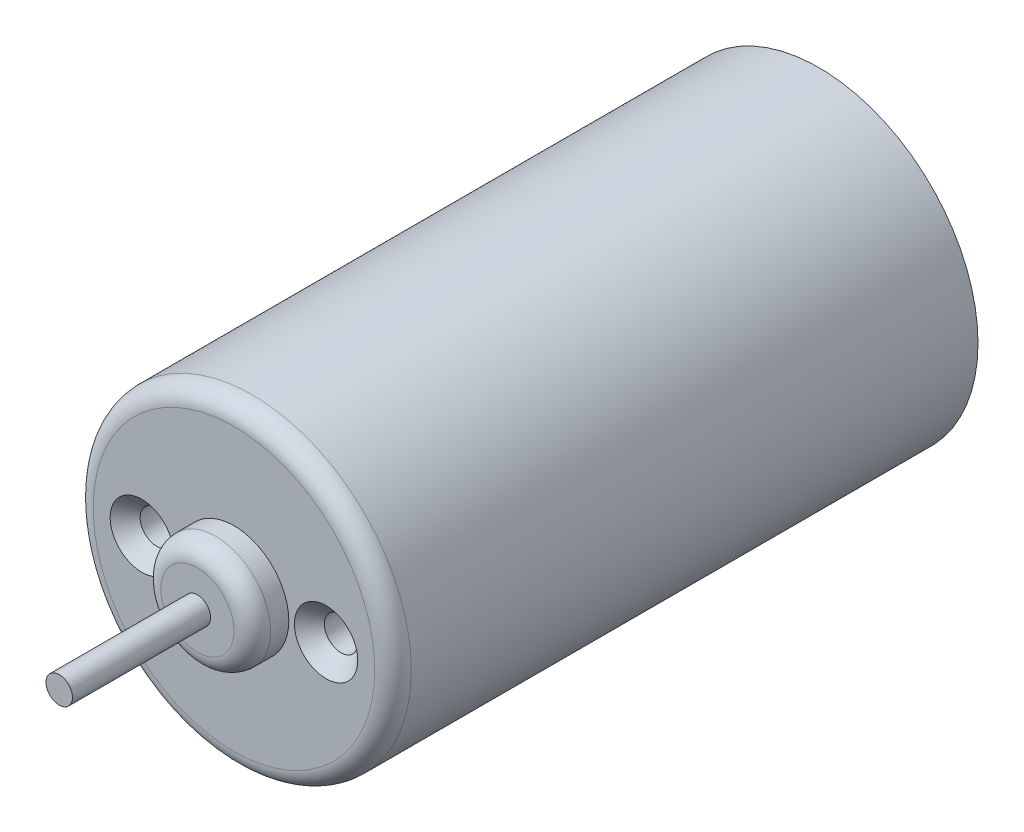
from build123d import *

# Parameters (mm, degrees)
SKETCH1_R                                         = 13.81125
BOSS_EXTRUDE1_DEPTH                               = 50.8
FILLET1_R                                         = 1.5875
SKETCH2_R                                         = 4.7625
BOSS_EXTRUDE2_DEPTH                               = 3.175
FILLET2_R                                         = 1.5875
CSK_FOR_M2_5_FLAT_HEAD_MACHINE_SCREW1_D           = 2.9
CSK_FOR_M2_5_FLAT_HEAD_MACHINE_SCREW1_DEPTH       = 12.7
CSK_FOR_M2_5_FLAT_HEAD_MACHINE_SCREW1_CSINK_D     = 5.5
CSK_FOR_M2_5_FLAT_HEAD_MACHINE_SCREW1_CSINK_ANGLE = 90
CSK_FOR_M2_5_FLAT_HEAD_MACHINE_SCREW1_TIP         = 0.871247898
SKETCH5_R                                         = 1.15
BOSS_EXTRUDE3_DEPTH                               = 12


with BuildPart() as part:
    # Sketch1 → Boss-Extrude1 (new body)
    with BuildSketch(Plane.XY):
        Circle(SKETCH1_R)
    extrude(amount=BOSS_EXTRUDE1_DEPTH)

    # Fillet1
    fillet1_edges = [part.edges().sort_by_distance(p)[0] for p in [
        (-13.81125, 0, 50.8),
    ]]
    fillet(fillet1_edges, radius=FILLET1_R)

    # Sketch2 → Boss-Extrude2 (add)
    with BuildSketch(Plane.XY.offset(50.8)):
        Circle(SKETCH2_R)
    extrude(amount=BOSS_EXTRUDE2_DEPTH)

    # Fillet2
    fillet2_edges = [part.edges().sort_by_distance(p)[0] for p in [
        (-4.7625, 0, 53.975),
    ]]
    fillet(fillet2_edges, radius=FILLET2_R)

    # CSK for M2.5 Flat Head Machine Screw1
    with Locations(Plane.XY.offset(50.8)):
        with Locations((-8.001, 0), (8.001, 0)):
            CounterSinkHole(CSK_FOR_M2_5_FLAT_HEAD_MACHINE_SCREW1_D / 2, CSK_FOR_M2_5_FLAT_HEAD_MACHINE_SCREW1_CSINK_D / 2, depth=CSK_FOR_M2_5_FLAT_HEAD_MACHINE_SCREW1_DEPTH, counter_sink_angle=CSK_FOR_M2_5_FLAT_HEAD_MACHINE_SCREW1_CSINK_ANGLE)
            with Locations((0, 0, -(CSK_FOR_M2_5_FLAT_HEAD_MACHINE_SCREW1_DEPTH + CSK_FOR_M2_5_FLAT_HEAD_MACHINE_SCREW1_TIP / 2))):  # 118° drill point
                Cone(0, CSK_FOR_M2_5_FLAT_HEAD_MACHINE_SCREW1_D / 2, CSK_FOR_M2_5_FLAT_HEAD_MACHINE_SCREW1_TIP, mode=Mode.SUBTRACT)

    # Sketch5 → Boss-Extrude3 (add)
    with BuildSketch(Plane.XY.offset(53.975)):
        Circle(SKETCH5_R)
    extrude(amount=BOSS_EXTRUDE3_DEPTH)


solid = part.part
